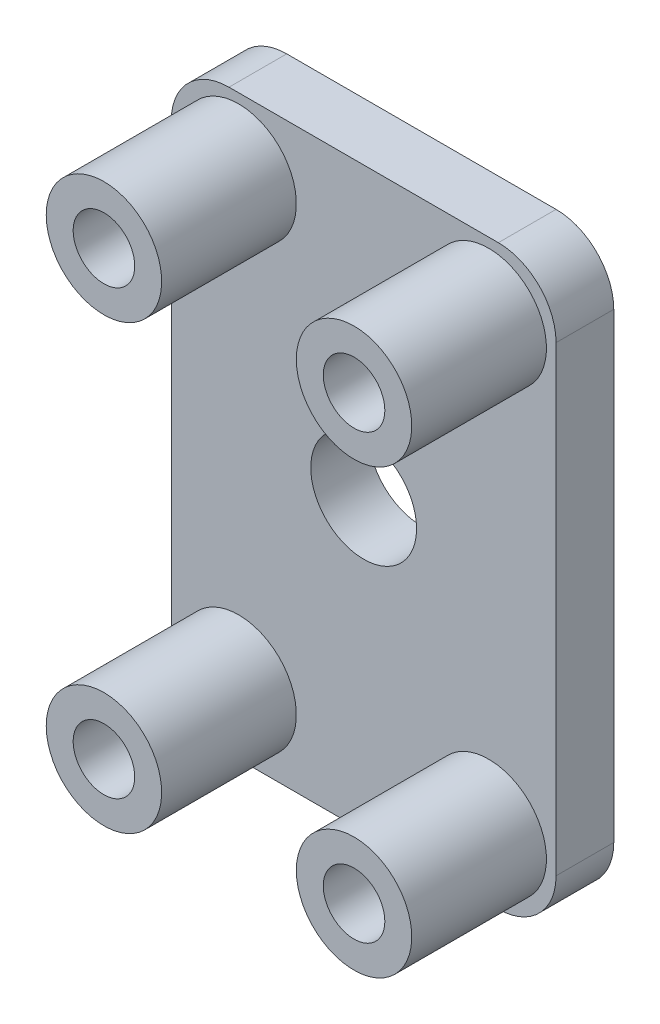
from build123d import *
from build123d.topology import SkipClean

# Parameters (mm, degrees)
SKETCH1_W                  = 20
SKETCH1_H                  = 30
BOSS_EXTRUDE1_DEPTH        = 3
F_3_2_3_2_DIAMETER_HOLE1_D = 3.2
SKETCH5_R                  = 3
SKETCH5_R_2                = 1.6
BOSS_EXTRUDE2_DEPTH        = 20
SKETCH6_R                  = 2.75
CUT_EXTRUDE1_DEPTH         = 27.925824036
SKETCH7_W                  = 20
SKETCH7_H                  = 40
CUT_EXTRUDE2_DEPTH         = 34.970575503
FILLET1_R                  = 3


with BuildPart() as part:
    # Sketch1 → Boss-Extrude1 (new body)
    with BuildSketch(Plane.XY):
        Rectangle(SKETCH1_W, SKETCH1_H)
    extrude(amount=BOSS_EXTRUDE1_DEPTH)

    # Ø3.2 (3.2) Diameter Hole1 (through all)
    with Locations(Plane.XY.offset(3)):
        with Locations((-6.5, 11.5), (6.5, 11.5), (6.5, -11.5), (-6.5, -11.5)):
            Hole(F_3_2_3_2_DIAMETER_HOLE1_D / 2)

    # Sketch5 → Boss-Extrude2 (add)
    # profile 1 of 4: a face of its own
    with SkipClean():  # the faces are left unmerged after this step: merging them gives an invalid solid
        with BuildSketch(Plane.XY.offset(3)):
            with Locations((-6.5, 11.5)):
                Circle(SKETCH5_R)
            with Locations((-6.5, 11.5)):
                Circle(SKETCH5_R_2, mode=Mode.SUBTRACT)
        # profile 2 of 4: a face of its own
        with BuildSketch(Plane.XY.offset(3)):
            with Locations((6.5, 11.5)):
                Circle(SKETCH5_R)
            with Locations((6.5, 11.5)):
                Circle(SKETCH5_R_2, mode=Mode.SUBTRACT)
        # profile 3 of 4: a face of its own
        with BuildSketch(Plane.XY.offset(3)):
            with Locations((6.5, -11.5)):
                Circle(SKETCH5_R)
            with Locations((6.5, -11.5)):
                Circle(SKETCH5_R_2, mode=Mode.SUBTRACT)
        # profile 4 of 4: a face of its own
        with BuildSketch(Plane.XY.offset(3)):
            with Locations((-6.5, -11.5)):
                Circle(SKETCH5_R)
            with Locations((-6.5, -11.5)):
                Circle(SKETCH5_R_2, mode=Mode.SUBTRACT)
        extrude(amount=BOSS_EXTRUDE2_DEPTH)
    add(part.part.scale(1), mode=Mode.REPLACE)  # the faces are merged on a copy

    # Sketch6 → Cut-Extrude1 (cut, through all)
    with BuildSketch(Plane.XY.offset(3)):
        Circle(SKETCH6_R)
    extrude(amount=-CUT_EXTRUDE1_DEPTH, mode=Mode.SUBTRACT)

    # Sketch7 → Cut-Extrude2 (cut, through all)
    with BuildSketch(Plane(origin=(10, 0, 0), x_dir=(0, 0, -1), z_dir=(1, 0, 0))):
        with Locations((-20, 0)):
            Rectangle(SKETCH7_W, SKETCH7_H)
    extrude(amount=-CUT_EXTRUDE2_DEPTH, mode=Mode.SUBTRACT)

    # Fillet1
    fillet1_edges = [part.edges().sort_by_distance(p)[0] for p in [
        (10, -15, 1.5),
        (-10, -15, 1.5),
        (-10, 15, 1.5),
        (10, 15, 1.5),
    ]]
    fillet(fillet1_edges, radius=FILLET1_R)


solid = part.part
